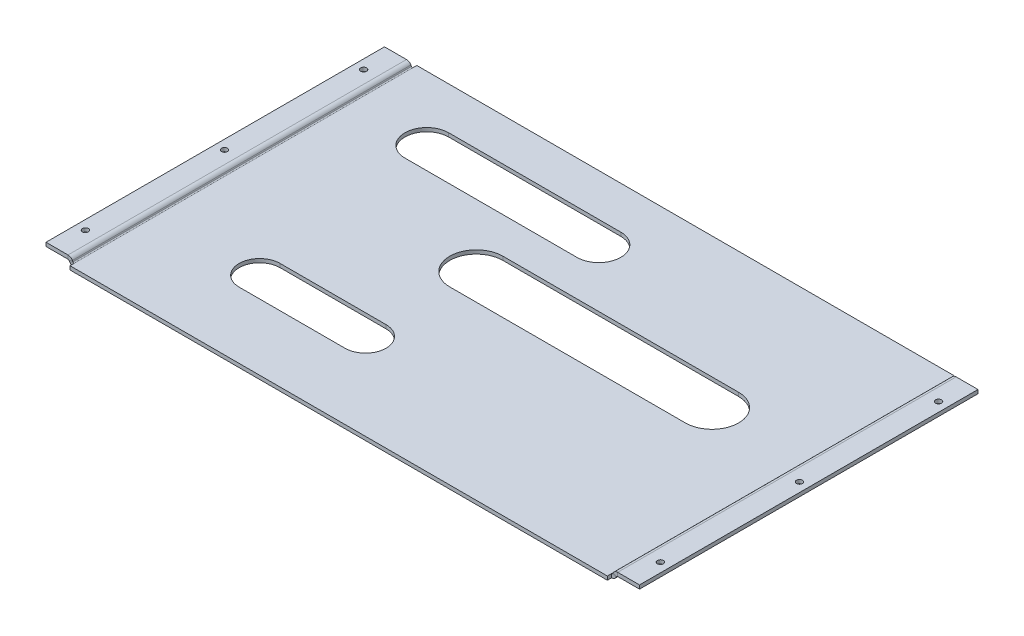
from build123d import *

# Parameters (mm, degrees)
SKETCH_1_W             = 320
SKETCH_1_H             = 182.5
SM_BASE_FLANGE_1_DEPTH = 2
OTHER_START            = -91.25
OTHER_1_DEPTH          = 182.5
OTHER_1_2_DEPTH        = 182.5
OTHER_4_DEPTH          = 182.5
OTHER_4_2_DEPTH        = 182.5
SKETCH_8_R             = 1.6
CUT_EXTRUDE_1_DEPTH    = 10
EXTRUDE_1_DEPTH        = 93.5
EXTRUDE_1_DEPTH_BACK   = 93.5
SKETCH_9_W             = 289.740046506
SKETCH_9_H             = 2
CUT_EXTRUDE_2_DEPTH    = 93.75


# Read off the part's stored shape, not the designer's step: Изгиб1, Изгиб4
# Sheet-metal steps are written as plain solids
with BuildPart() as part:
    # Sketch 1 → Базовая кромка1 (new body)
    with BuildSketch(Plane(origin=(0, 0, 0), x_dir=(1, 0, 0), z_dir=(0, 1, 0))):
        Rectangle(SKETCH_1_W, SKETCH_1_H)
    extrude(amount=-SM_BASE_FLANGE_1_DEPTH)

    # Other 1 outline → Other 1 (cut)
    with BuildSketch(Plane.XY.offset(OTHER_START)):
        with BuildLine():
            ThreePointArc((-144.820023253, -2), (-146.188323253, -1.63336512), (-147.189988373, -0.6317))
            Line((-147.189988373, -0.6317), (-147.486400002, -0.1183))
            ThreePointArc((-147.486400002, -0.1183), (-147.525930573, -0.05704621), (-147.571322452, 0))
            Line((-147.571322452, 0), (-160, 0))
            Line((-160, 0), (-160, -2))
            Line((-160, -2), (-144.820023253, -2))
        make_face()
    extrude(amount=OTHER_1_DEPTH, mode=Mode.SUBTRACT)

    # Other 1 2 outline → Other 1 2 (add)
    with BuildSketch(Plane.XY.offset(OTHER_START)):
        with BuildLine():
            ThreePointArc((-148.124314314, 0.25), (-147.820875688, 0.184596365), (-147.571322452, 0))
            Line((-147.571322452, 0), (-144.820023253, 0))
            ThreePointArc((-144.820023253, 0), (-145.188323253, 0.098685688), (-145.457937566, 0.3683))
            Line((-145.457937566, 0.3683), (-145.754349194, 0.8817))
            ThreePointArc((-145.754349194, 0.8817), (-146.756014314, 1.88336512), (-148.124314314, 2.25))
            Line((-148.124314314, 2.25), (-160, 2.25))
            Line((-160, 2.25), (-160, 0.25))
            Line((-160, 0.25), (-148.124314314, 0.25))
        make_face()
    extrude(amount=OTHER_1_2_DEPTH)

    # Other 4 outline → Other 4 (cut)
    with BuildSketch(Plane.XY.offset(OTHER_START)):
        with BuildLine():
            Line((160, 0), (147.671322452, 0))
            ThreePointArc((147.671322452, 0), (147.625930573, -0.05704621), (147.586400002, -0.1183))
            Line((147.586400002, -0.1183), (147.289988373, -0.6317))
            ThreePointArc((147.289988373, -0.6317), (146.288323253, -1.63336512), (144.920023253, -2))
            Line((144.920023253, -2), (160, -2))
            Line((160, -2), (160, 0))
        make_face()
    extrude(amount=OTHER_4_DEPTH, mode=Mode.SUBTRACT)

    # Other 4 2 outline → Other 4 2 (add)
    with BuildSketch(Plane.XY.offset(OTHER_START)):
        with BuildLine():
            Line((148.224314314, 0.25), (160, 0.25))
            Line((160, 0.25), (160, 2.25))
            Line((160, 2.25), (148.224314314, 2.25))
            ThreePointArc((148.224314314, 2.25), (146.856014314, 1.88336512), (145.854349194, 0.8817))
            Line((145.854349194, 0.8817), (145.557937566, 0.3683))
            ThreePointArc((145.557937566, 0.3683), (145.288323253, 0.098685688), (144.920023253, 0))
            Line((144.920023253, 0), (147.671322452, 0))
            ThreePointArc((147.671322452, 0), (147.920875688, 0.184596365), (148.224314314, 0.25))
        make_face()
    extrude(amount=OTHER_4_2_DEPTH)

    # Эскиз8 → Вырез-Вытянуть1 (cut)
    with BuildSketch(Plane(origin=(0, 2.25, 0), x_dir=(1, 0, 0), z_dir=(0, 1, 0))):
        with Locations(Location((-155, 0, 0), (0, 0, 270))):
            Circle(SKETCH_8_R)
        with Locations(Location((-155, 75, 0), (0, 0, 270))):
            Circle(SKETCH_8_R)
        with Locations(Location((-155, -75, 0), (0, 0, 270))):
            Circle(SKETCH_8_R)
        with Locations(Location((155, -75, 0), (0, 0, 270))):
            Circle(SKETCH_8_R)
        with Locations(Location((155, 75, 0), (0, 0, 270))):
            Circle(SKETCH_8_R)
        with Locations(Location((155, 0, 0), (0, 0, 270))):
            Circle(SKETCH_8_R)
    extrude(amount=-CUT_EXTRUDE_1_DEPTH, mode=Mode.SUBTRACT)

    # Эскиз9 → Бобышка-Вытянуть1 (add, two sides: drawn at the far end of the back side and taken through both)
    with BuildSketch(Plane.XY.offset(-EXTRUDE_1_DEPTH_BACK)):
        with Locations((0.05, -1)):
            Rectangle(SKETCH_9_W, SKETCH_9_H)
    extrude(amount=EXTRUDE_1_DEPTH + EXTRUDE_1_DEPTH_BACK)

    # Эскиз10 → Вырез-Вытянуть2 (cut)
    with BuildSketch(Plane(origin=(0, 0, 0), x_dir=(1, 0, 0), z_dir=(0, 1, 0))):
        with BuildLine():
            Line((-12.037112187, 47.06815468), (-104.806151311, 47.06815468))
            ThreePointArc((-104.806151311, 47.06815468), (-116.613119927, 58.875123295), (-104.806151311, 70.682091911))
            Line((-104.806151311, 70.682091911), (-12.037112187, 70.682091911))
            ThreePointArc((-12.037112187, 70.682091911), (-0.230143571, 58.875123295), (-12.037112187, 47.06815468))
        make_face()
        with BuildLine():
            Line((-32.558748115, 27.670991954), (94.506723655, 27.670991954))
            ThreePointArc((94.506723655, 27.670991954), (108.843756974, 13.333958635), (94.506723655, -1.003074685))
            Line((94.506723655, -1.003074685), (-32.558748115, -1.003074685))
            ThreePointArc((-32.558748115, -1.003074685), (-46.895781434, 13.333958635), (-32.558748115, 27.670991954))
        make_face()
        with BuildLine():
            Line((-89.244817746, -35.777942633), (-32.143884778, -35.777942633))
            ThreePointArc((-32.143884778, -35.777942633), (-21.089903693, -46.831923718), (-32.143884778, -57.885904803))
            Line((-32.143884778, -57.885904803), (-89.244817746, -57.885904803))
            ThreePointArc((-89.244817746, -57.885904803), (-100.298798831, -46.831923718), (-89.244817746, -35.777942633))
        make_face()
    extrude(amount=-CUT_EXTRUDE_2_DEPTH, mode=Mode.SUBTRACT)


solid = part.part
